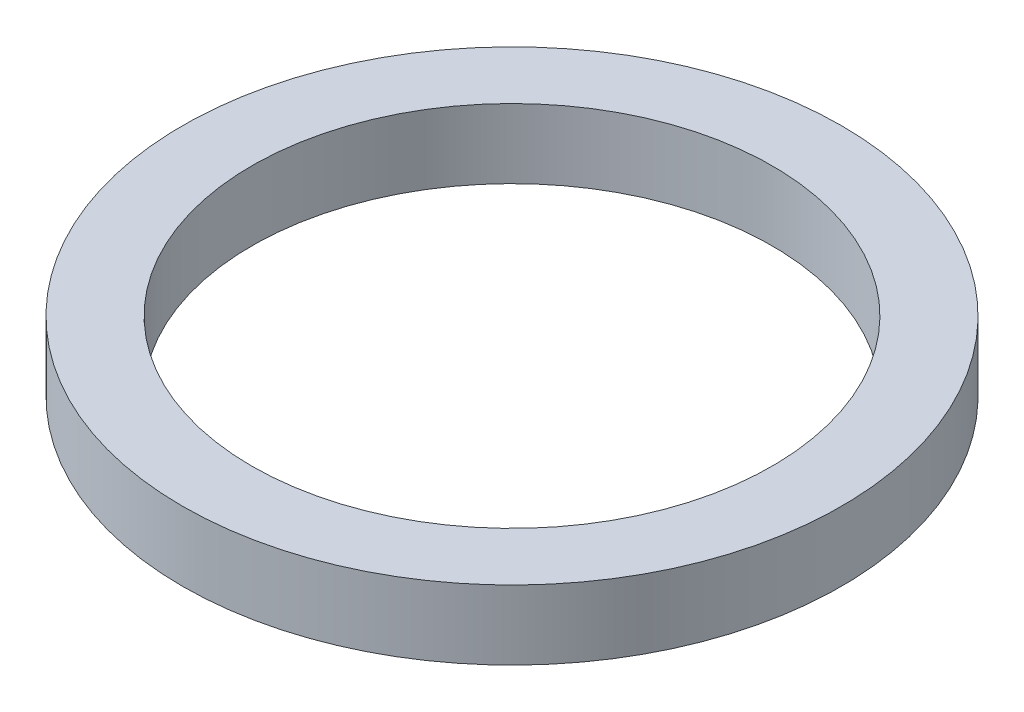
from build123d import *

# Parameters (mm, degrees)
SKETCH1_R           = 47.5
SKETCH1_R_2         = 37.5
BOSS_EXTRUDE1_DEPTH = 5


with BuildPart() as part:
    # Sketch1 → Boss-Extrude1 (new, symmetric)
    with BuildSketch(Plane(origin=(0, 0, 0), x_dir=(1, 0, 0), z_dir=(0, 1, 0))):
        Circle(SKETCH1_R)
        Circle(SKETCH1_R_2, mode=Mode.SUBTRACT)
    extrude(amount=BOSS_EXTRUDE1_DEPTH, both=True)


solid = part.part
